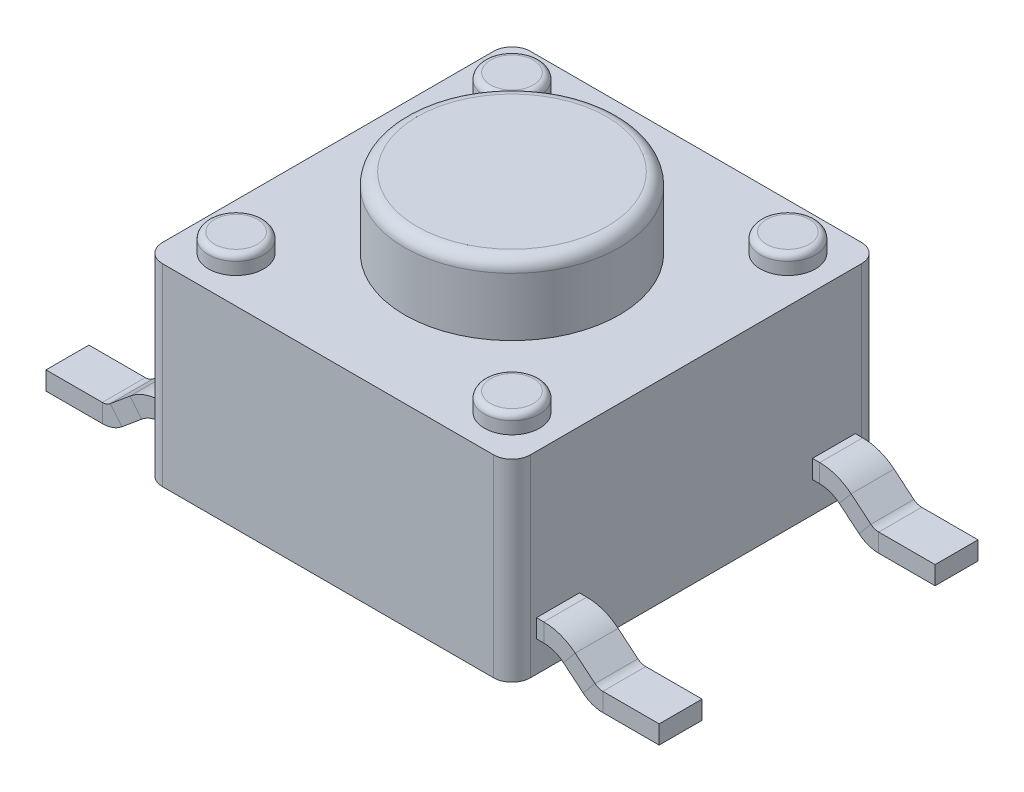
from build123d import *

# Parameters (mm, degrees)
BOSS_EXTRUDE1_DEPTH     = 3.15
SKETCH2_R               = 1.75
BOSS_EXTRUDE2_DEPTH     = 1.15
FILLET1_R               = 0.2
SKETCH3_R               = 0.45
BOSS_EXTRUDE3_DEPTH     = 0.3
SKETCH4_W               = 0.7
SKETCH4_H               = 0.3
MIRROR2_COPY_1_SKETCH_W = 0.7
MIRROR2_COPY_1_SKETCH_H = 0.3
MIRROR2_COPY_2_SKETCH_W = 0.7
MIRROR2_COPY_2_SKETCH_H = 0.3
FILLET2_R               = 0.1


with BuildPart() as part:
    # Sketch1 → Boss-Extrude1 (new body)
    with BuildSketch(Plane(origin=(0, 0, 0), x_dir=(1, 0, 0), z_dir=(0, 1, 0))):
        with BuildLine():
            Line((-2.7, 3), (2.7, 3))
            ThreePointArc((2.7, 3), (2.912132034, 2.912132034), (3, 2.7))
            Line((3, 2.7), (3, -2.7))
            ThreePointArc((3, -2.7), (2.912132034, -2.912132034), (2.7, -3))
            Line((2.7, -3), (-2.7, -3))
            ThreePointArc((-2.7, -3), (-2.912132034, -2.912132034), (-3, -2.7))
            Line((-3, -2.7), (-3, 2.7))
            ThreePointArc((-3, 2.7), (-2.912132034, 2.912132034), (-2.7, 3))
        make_face()
    extrude(amount=BOSS_EXTRUDE1_DEPTH)

    # Sketch2 → Boss-Extrude2 (add)
    with BuildSketch(Plane(origin=(0, 3.15, 0), x_dir=(1, 0, 0), z_dir=(0, 1, 0))):
        Circle(SKETCH2_R)
    extrude(amount=BOSS_EXTRUDE2_DEPTH)

    # Fillet1
    fillet1_edges = [part.edges().sort_by_distance(p)[0] for p in [
        (-1.75, 4.3, 0),
    ]]
    fillet(fillet1_edges, radius=FILLET1_R)

    # Sketch3 → Boss-Extrude3 (add)
    with BuildSketch(Plane(origin=(0, 3.15, 0), x_dir=(1, 0, 0), z_dir=(0, 1, 0))):
        with Locations((-2.25, 2.25)):
            Circle(SKETCH3_R)
        with Locations((2.25, 2.25)):
            Circle(SKETCH3_R)
        with Locations((2.25, -2.25)):
            Circle(SKETCH3_R)
        with Locations((-2.25, -2.25)):
            Circle(SKETCH3_R)
    extrude(amount=BOSS_EXTRUDE3_DEPTH)

    # Sweep1: sweep along a path in Sketch5
    with BuildLine(Plane.XY.offset(2.6)) as sweep1_path:
        Line((3, 0.5), (3.118975032, 0.5))
        ThreePointArc((3.118975032, 0.5), (3.289187664, 0.470135789), (3.439067232, 0.38411064))
        Line((3.439067232, 0.38411064), (3.760932768, 0.11588936))
        ThreePointArc((3.760932768, 0.11588936), (3.910812336, 0.029864211), (4.081024968, 0))
        Line((4.081024968, 0), (5, 0))
    # Sketch4 → Sweep1 (sweep)
    with BuildSketch(Plane(origin=(3, 0, 0), x_dir=(0, 0, -1), z_dir=(1, 0, 0))):
        with Locations((-2.25, 0.65)):
            Rectangle(SKETCH4_W, SKETCH4_H)
    sweep1 = sweep(path=sweep1_path.line)

    # Mirror1: Sweep1 across plane
    add(sweep1.mirror(Plane.XY))

    # Mirror2 copy 1: sweep along a path in Mirror2 copy 1 path
    with BuildLine(Plane(origin=(0, 0, -2.6), x_dir=(-1, 0, 0), z_dir=(0, 0, -1))) as mirror2_copy_1_path:
        Line((3, 0.5), (3.118975032, 0.5))
        ThreePointArc((3.118975032, 0.5), (3.289187664, 0.470135789), (3.439067232, 0.38411064))
        Line((3.439067232, 0.38411064), (3.760932768, 0.11588936))
        ThreePointArc((3.760932768, 0.11588936), (3.910812336, 0.029864211), (4.081024968, 0))
        Line((4.081024968, 0), (5, 0))
    # Mirror2 copy 1 sketch → Mirror2 copy 1 (sweep)
    with BuildSketch(Plane.ZY.offset(3)):
        with Locations((-2.25, 0.65)):
            Rectangle(MIRROR2_COPY_1_SKETCH_W, MIRROR2_COPY_1_SKETCH_H)
    sweep(path=mirror2_copy_1_path.line)

    # Mirror2 copy 2: sweep along a path in Mirror2 copy 2 path
    with BuildLine(Plane(origin=(0, 0, 2.6), x_dir=(-1, 0, 0), z_dir=(0, 0, 1))) as mirror2_copy_2_path:
        Line((3, -0.5), (3.118975032, -0.5))
        ThreePointArc((3.118975032, -0.5), (3.289187664, -0.470135789), (3.439067232, -0.38411064))
        Line((3.439067232, -0.38411064), (3.760932768, -0.11588936))
        ThreePointArc((3.760932768, -0.11588936), (3.910812336, -0.029864211), (4.081024968, 0))
        Line((4.081024968, 0), (5, 0))
    # Mirror2 copy 2 sketch → Mirror2 copy 2 (sweep)
    with BuildSketch(Plane(origin=(-3, 0, 0), x_dir=(0, 0, -1), z_dir=(-1, 0, 0))):
        with Locations((-2.25, -0.65)):
            Rectangle(MIRROR2_COPY_2_SKETCH_W, MIRROR2_COPY_2_SKETCH_H)
    sweep(path=mirror2_copy_2_path.line)

    # Fillet2
    fillet2_edges = [part.edges().sort_by_distance(p)[0] for p in [
        (-2.7, 3.45, -2.25),
        (1.8, 3.45, -2.25),
        (1.8, 3.45, 2.25),
        (-2.7, 3.45, 2.25),
    ]]
    fillet(fillet2_edges, radius=FILLET2_R)


solid = part.part
